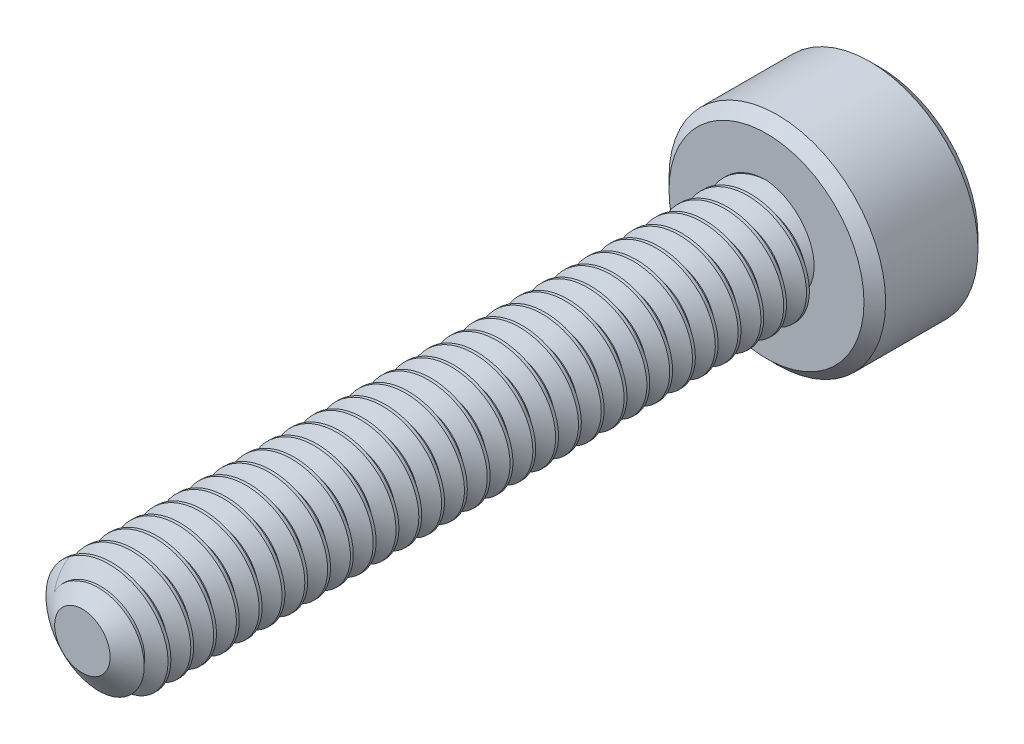
from build123d import *

# Parameters (mm, degrees)
SKETCH1_R          = 1
EXTRUDE1_DEPTH     = 12
CUT_SWEEP1_PITCH   = 0.4
SKETCH6_R          = 1.9
EXTRUDE2_DEPTH     = 2
CUT_EXTRUDE1_DEPTH = 1.125
CHAMFER1_SIZE      = 0.19


with BuildPart() as part:
    # Sketch1 → Extrude1 (new body)
    with BuildSketch(Plane.XY):
        Circle(SKETCH1_R)
    extrude(amount=-EXTRUDE1_DEPTH)

    # Cut-Sweep1: the profile of Sketch3 profile screwed along a right-hand helix of 31 turns, 6 arcs to a turn; built about Z, then put on its axis
    cut_sweep1_z = Axis((0, 0, 0), (0, 0, 1))
    cut_sweep1_corners = [(1.0003, 0, -0.350173205), (0.740192379, 0, -0.2), (0.740192379, 0, -0.15), (1.0003, 0, 0.000173205)]
    with BuildLine(mode=Mode.PRIVATE) as cut_sweep1_profile:
        Line(cut_sweep1_corners[0], cut_sweep1_corners[1])
        Line(cut_sweep1_corners[1], cut_sweep1_corners[2])
        Line(cut_sweep1_corners[2], cut_sweep1_corners[3])
        Line(cut_sweep1_corners[3], cut_sweep1_corners[0])
    cut_sweep1_cap = Face(cut_sweep1_profile.wire())
    cut_sweep1_turn_angles = [0, 30, 60, 90, 120, 150, 180, 210, 240, 270, 300, 330, 360]
    cut_sweep1_turn_weights = [1, 0.8660254037844387, 1, 0.8660254037844387, 1, 0.8660254037844387, 1, 0.8660254037844387, 1, 0.8660254037844387, 1, 0.8660254037844387, 1]
    cut_sweep1_turn_rails = [Edge.make_bspline([Vector(p[0], p[1], 0).rotate(cut_sweep1_z, cut_sweep1_turn_angles[k]) / cut_sweep1_turn_weights[k] + Vector(0, 0, p[2] + CUT_SWEEP1_PITCH * cut_sweep1_turn_angles[k] / 360) for k in range(13)], [0, 0, 0, 1, 1, 2, 2, 3, 3, 4, 4, 5, 5, 6, 6, 6], 2, cut_sweep1_turn_weights) for p in cut_sweep1_corners]
    cut_sweep1_turn_sides = [Face.make_surface_from_curves(cut_sweep1_turn_rails[p[0]], cut_sweep1_turn_rails[p[1]]) for p in [(0, 1), (1, 2), (2, 3), (3, 0)]]
    cut_sweep1 = Plane(origin=(0, 0, 0), x_dir=(0, 1, 0), z_dir=(0, 0, -1)) * Solid(Shell([*[p.moved(Location((0, 0, CUT_SWEEP1_PITCH * i))) for i in range(31) for p in cut_sweep1_turn_sides], cut_sweep1_cap, cut_sweep1_cap.rotate(cut_sweep1_z, 11160).moved(Location((0, 0, CUT_SWEEP1_PITCH * 11160 / 360)))]))
    add(cut_sweep1, mode=Mode.SUBTRACT)

    # Sketch4 → Cut-Revolve1 (revolve, cut)
    with BuildSketch(Plane(origin=(0, 0, 0), x_dir=(0, 0, -1), z_dir=(1, 0, 0)), mode=Mode.PRIVATE) as cut_revolve1_sk:
        Polygon((0.35977197, 1), (0, 0.486192379), (0, 1), align=None)
    revolve(cut_revolve1_sk.sketch.rotate(Axis((0, 0, 0), (0, 0, -1)), 278.428757719), axis=Axis((0, 0, 0), (0, 0, -1)), mode=Mode.SUBTRACT)

    # Sketch6 → Extrude2 (add)
    with BuildSketch(Plane(origin=(0, 0, -12), x_dir=(-1, 0, 0), z_dir=(0, 0, -1))):
        Circle(SKETCH6_R)
    extrude(amount=EXTRUDE2_DEPTH)

    # Sketch7 → Cut-Extrude1 (cut)
    with BuildSketch(Plane(origin=(0, 0, -14), x_dir=(-1, 0, 0), z_dir=(0, 0, -1))):
        Polygon((0, 0.866025404), (-0.75, 0.433012702), (-0.75, -0.433012702), (0, -0.866025404), (0.75, -0.433012702), (0.75, 0.433012702), align=None)
    extrude(amount=-CUT_EXTRUDE1_DEPTH, mode=Mode.SUBTRACT)

    # Cut-Extrude2 cone 1 section (through the dimple's axis) → Cut-Extrude2 (revolve, cut)
    with BuildSketch(Plane(origin=(0, 0, -14), x_dir=(0, 1, 0), z_dir=(1, 0, 0))):
        Polygon((0, 0), (0.866025404, 0), (0, 0.866025404), align=None)
    revolve(axis=Axis((0, 0, -14), (0, 0, 1)), mode=Mode.SUBTRACT)

    # Chamfer1
    chamfer1_edges = [part.edges().sort_by_distance(p)[0] for p in [
        (1.9, 0, -12),
        (1.9, 0, -14),
    ]]
    chamfer(chamfer1_edges, length=CHAMFER1_SIZE)


solid = part.part
